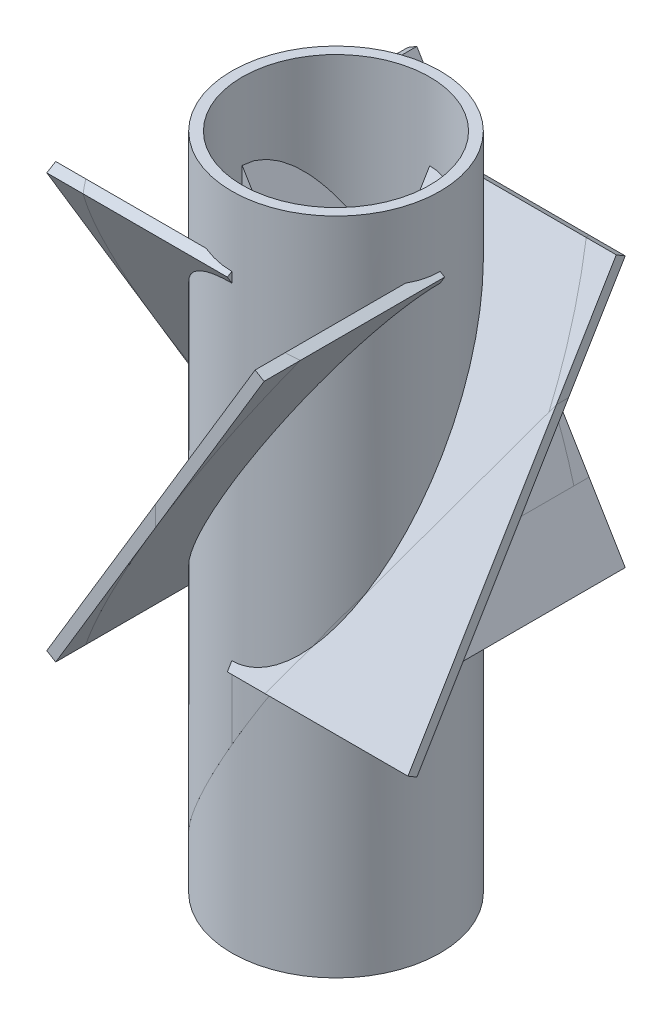
from build123d import *

# Parameters (mm, degrees)
SKETCH_1_R                     = 30
SKETCH_1_R_2                   = 27
EXTRUDE_3_DEPTH                = 190
SKETCH_5_W                     = 116.619037897
SKETCH_5_H                     = 52
EXTRUDE_4_DEPTH                = 1.5
SKETCH_6_W                     = 116.619037897
SKETCH_6_H                     = 52
EXTRUDE_5_DEPTH                = 1.5
SKETCH_7_W                     = 116.619037897
SKETCH_7_H                     = 52
EXTRUDE_6_DEPTH                = 1.5
SKETCH_8_W                     = 116.619037897
SKETCH_8_H                     = 52
EXTRUDE_7_DEPTH                = 1.5
SPLIT_BODIES_1_SURFACE_1_BACK  = 241.275
SPLIT_BODIES_1_SURFACE_1_DEPTH = 482.55
SPLIT_BODIES_1_SURFACE_2_BACK  = 241.275
SPLIT_BODIES_1_SURFACE_2_DEPTH = 482.55
SPLIT_BODIES_2_SURFACE_3_BACK  = 241.275
SPLIT_BODIES_2_SURFACE_3_DEPTH = 482.55
SPLIT_BODIES_2_SURFACE_4_BACK  = 241.275
SPLIT_BODIES_2_SURFACE_4_DEPTH = 482.55
SPLIT_BODIES_3_SURFACE_5_BACK  = 241.275
SPLIT_BODIES_3_SURFACE_5_DEPTH = 482.55
SPLIT_BODIES_3_SURFACE_6_BACK  = 241.275
SPLIT_BODIES_3_SURFACE_6_DEPTH = 482.55


with BuildPart() as part:
    # 草图1 → 凸台-拉伸3 (new body)
    with BuildSketch(Plane(origin=(0, 0, 0), x_dir=(1, 0, 0), z_dir=(0, 1, 0))):
        Circle(SKETCH_1_R)
        Circle(SKETCH_1_R_2, mode=Mode.SUBTRACT)
    extrude(amount=EXTRUDE_3_DEPTH)

    # 草图5 → 凸台-拉伸4 (add, symmetric)
    with BuildSketch(Plane(origin=(0, 31.764705882, -52.941176471), x_dir=(0, -0.8574929257125442, -0.5144957554275265), z_dir=(0, -0.5144957554275265, 0.8574929257125442))):
        with Locations((-102.899151086, -26)):
            Rectangle(SKETCH_5_W, SKETCH_5_H)
    extrude(amount=EXTRUDE_4_DEPTH, both=True)

    # 草图6 → 凸台-拉伸5 (add, symmetric)
    with BuildSketch(Plane(origin=(0, 31.764705882, 52.941176471), x_dir=(0, -0.8574929257125442, 0.5144957554275265), z_dir=(0, 0.5144957554275265, 0.8574929257125442))):
        with Locations((-102.899151086, 26)):
            Rectangle(SKETCH_6_W, SKETCH_6_H)
    extrude(amount=EXTRUDE_5_DEPTH, both=True)

    # 草图7 → 凸台-拉伸6 (add, symmetric)
    with BuildSketch(Plane(origin=(52.941176471, 31.764705882, 0), x_dir=(0.5144957554275265, -0.8574929257125442, 0), z_dir=(-0.8574929257125442, -0.5144957554275265, 0))):
        with Locations((-102.899151086, -26)):
            Rectangle(SKETCH_7_W, SKETCH_7_H)
    extrude(amount=EXTRUDE_6_DEPTH, both=True)

    # 草图8 → 凸台-拉伸7 (add, symmetric)
    with BuildSketch(Plane(origin=(-52.941176471, 31.764705882, 0), x_dir=(-0.5144957554275265, -0.8574929257125442, 0), z_dir=(-0.8574929257125442, 0.5144957554275265, 0))):
        with Locations((-102.899151086, 26)):
            Rectangle(SKETCH_8_W, SKETCH_8_H)
    extrude(amount=EXTRUDE_7_DEPTH, both=True)


with BuildPart() as body_2:
    # Split Bodies 1: the piece behind the surface
    add(part.part)
    # Split Bodies 1 surface: a surface, the sketch's curves swept straight by 482.55 mm
    with BuildLine(Plane.XY.offset(-SPLIT_BODIES_1_SURFACE_1_BACK), mode=Mode.PRIVATE) as split_bodies_1_surface_1_path:
        Line((-30, 0), (64.21807319, 163.190489757))
    split_bodies_1_surface_1 = Shell.extrude(split_bodies_1_surface_1_path.wire(), (0 * SPLIT_BODIES_1_SURFACE_1_DEPTH, 0 * SPLIT_BODIES_1_SURFACE_1_DEPTH, 1 * SPLIT_BODIES_1_SURFACE_1_DEPTH))
    split(bisect_by=split_bodies_1_surface_1, keep=Keep.BOTTOM)


with BuildPart() as part_1:
    add(part.part)

    # Split Bodies 1: split by a surface, the side it looks to stays
    # Split Bodies 1 surface: a surface, the sketch's curves swept straight by 482.55 mm
    with BuildLine(Plane.XY.offset(-SPLIT_BODIES_1_SURFACE_2_BACK), mode=Mode.PRIVATE) as split_bodies_1_surface_2_path:
        Line((-30, 0), (64.21807319, 163.190489757))
    split_bodies_1_surface_2 = Shell.extrude(split_bodies_1_surface_2_path.wire(), (0 * SPLIT_BODIES_1_SURFACE_2_DEPTH, 0 * SPLIT_BODIES_1_SURFACE_2_DEPTH, 1 * SPLIT_BODIES_1_SURFACE_2_DEPTH))
    split(bisect_by=split_bodies_1_surface_2, keep=Keep.TOP)


with BuildPart() as body_3:
    # Split Bodies 2: the piece behind the surface
    add(part_1.part)
    # Split Bodies 2 surface: a surface, the sketch's curves swept straight by 482.55 mm
    with BuildLine(Plane(origin=(0, 0, 0), x_dir=(1, 0, 0), z_dir=(0, 1, 0)).offset(-SPLIT_BODIES_2_SURFACE_3_BACK), mode=Mode.PRIVATE) as split_bodies_2_surface_3_path:
        CenterArc((0, 0), 27, 0, 360)
    split_bodies_2_surface_3 = Shell.extrude(split_bodies_2_surface_3_path.wire(), (0 * SPLIT_BODIES_2_SURFACE_3_DEPTH, 1 * SPLIT_BODIES_2_SURFACE_3_DEPTH, 0 * SPLIT_BODIES_2_SURFACE_3_DEPTH))
    split(bisect_by=split_bodies_2_surface_3, keep=Keep.BOTTOM)


with BuildPart() as part_2:
    add(part_1.part)

    # Split Bodies 2: split by a surface, the side it looks to stays
    # Split Bodies 2 surface: a surface, the sketch's curves swept straight by 482.55 mm
    with BuildLine(Plane(origin=(0, 0, 0), x_dir=(1, 0, 0), z_dir=(0, 1, 0)).offset(-SPLIT_BODIES_2_SURFACE_4_BACK), mode=Mode.PRIVATE) as split_bodies_2_surface_4_path:
        CenterArc((0, 0), 27, 0, 360)
    split_bodies_2_surface_4 = Shell.extrude(split_bodies_2_surface_4_path.wire(), (0 * SPLIT_BODIES_2_SURFACE_4_DEPTH, 1 * SPLIT_BODIES_2_SURFACE_4_DEPTH, 0 * SPLIT_BODIES_2_SURFACE_4_DEPTH))
    split(bisect_by=split_bodies_2_surface_4, keep=Keep.TOP)


with BuildPart() as body_4:
    # Split Bodies 3: the piece behind the surface
    add(body_3.part)
    # Split Bodies 3 surface: a surface, the sketch's curves swept straight by 482.55 mm
    with BuildLine(Plane(origin=(0, 0, 0), x_dir=(1, 0, 0), z_dir=(0, 1, 0)).offset(-SPLIT_BODIES_3_SURFACE_5_BACK), mode=Mode.PRIVATE) as split_bodies_3_surface_5_path:
        CenterArc((0, 0), 52, 0, 360)
    split_bodies_3_surface_5 = Shell.extrude(split_bodies_3_surface_5_path.wire(), (0 * SPLIT_BODIES_3_SURFACE_5_DEPTH, 1 * SPLIT_BODIES_3_SURFACE_5_DEPTH, 0 * SPLIT_BODIES_3_SURFACE_5_DEPTH))
    split(bisect_by=split_bodies_3_surface_5, keep=Keep.BOTTOM)


with BuildPart() as body_3_1:
    add(body_3.part)

    # Split Bodies 3: split by a surface, the side it looks to stays
    # Split Bodies 3 surface: a surface, the sketch's curves swept straight by 482.55 mm
    with BuildLine(Plane(origin=(0, 0, 0), x_dir=(1, 0, 0), z_dir=(0, 1, 0)).offset(-SPLIT_BODIES_3_SURFACE_6_BACK), mode=Mode.PRIVATE) as split_bodies_3_surface_6_path:
        CenterArc((0, 0), 52, 0, 360)
    split_bodies_3_surface_6 = Shell.extrude(split_bodies_3_surface_6_path.wire(), (0 * SPLIT_BODIES_3_SURFACE_6_DEPTH, 1 * SPLIT_BODIES_3_SURFACE_6_DEPTH, 0 * SPLIT_BODIES_3_SURFACE_6_DEPTH))
    split(bisect_by=split_bodies_3_surface_6, keep=Keep.TOP)


solid = Compound([body_2.part, part_2.part, body_4.part, body_3_1.part])
